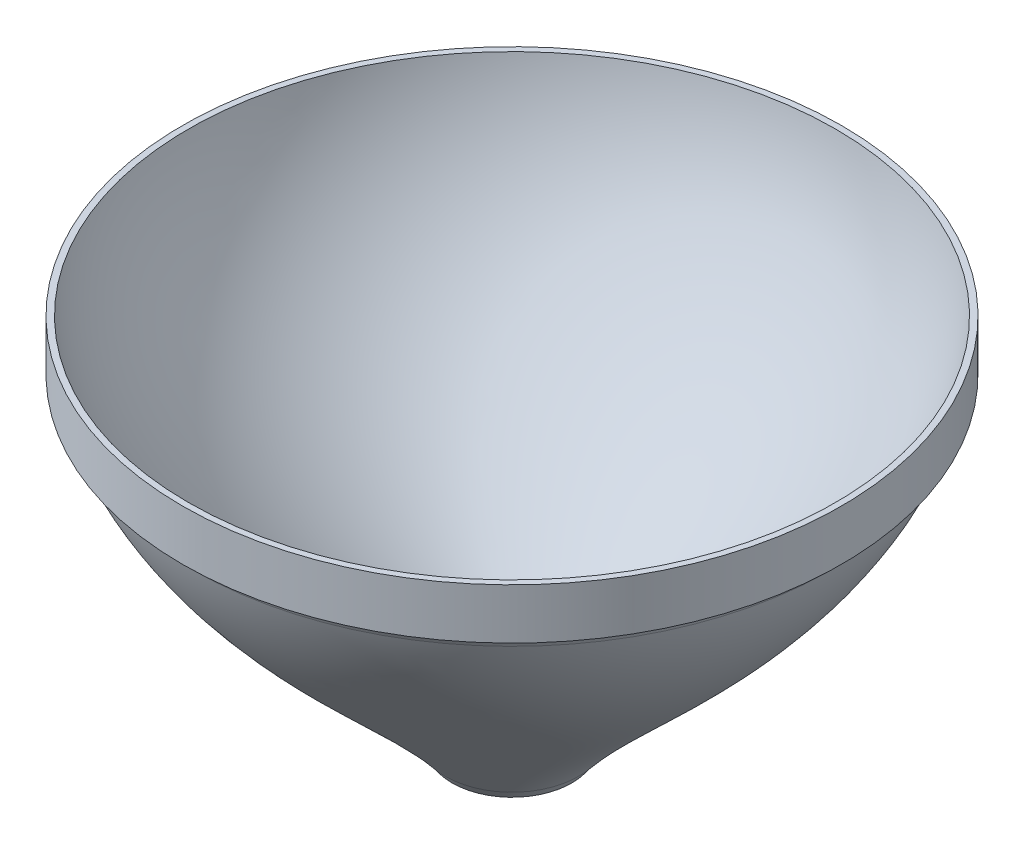
from build123d import *


with BuildPart() as part:
    # Sketch1 → Revolve1 (revolve)
    with BuildSketch(Plane.XY):
        with BuildLine():
            Line((-18.965787536, 128.746531407), (-18.165787536, 128.746531407))
            Line((-18.165787536, 128.746531407), (-17.557551318, 127.375382727))
            add(Edge.make_bspline(
                [(-17.557551318, 127.375382727), (-17.149252008, 126.282501553), (-16.237853417, 124.119682516), (-14.129979086, 120.024361387), (-9.75405026, 113.3263342), (-3.634824269, 106.585517876), (2.779766009, 100.345416982), (7.538915569, 95.819712917), (11.288948131, 92.106723437), (14.070545225, 89.115850224), (15.353268122, 87.629988), (15.982781636, 86.86452803)],
                knots=[0.117144833, 0.117144833, 0.117144833, 0.117144833, 0.169312009, 0.221479185, 0.325813538, 0.534482242, 0.638816594, 0.743150946, 0.847485298, 0.899652474, 0.95181965, 0.95181965, 0.95181965, 0.95181965], degree=3))
            Line((15.982781636, 86.86452803), (16.872016179, 85.656528888))
            Line((16.872016179, 85.656528888), (18.834212464, 85.656528888))
            add(Edge.make_bspline(
                [(-18.165787536, 135.456528888), (-14.45456026, 112.769537057), (7.622935344, 100.742541923), (18.834212464, 85.656528888)],
                knots=[0, 0, 0, 0, 1, 1, 1, 1], degree=3))
            Line((-18.165787536, 135.456528888), (-18.965787536, 135.456528888))
            Line((-18.965787536, 135.456528888), (-18.965787536, 128.746531407))
        make_face()
    revolve(axis=Axis((24.834212464, 148.471380655, 0), (0, -1, 0)))


solid = part.part
